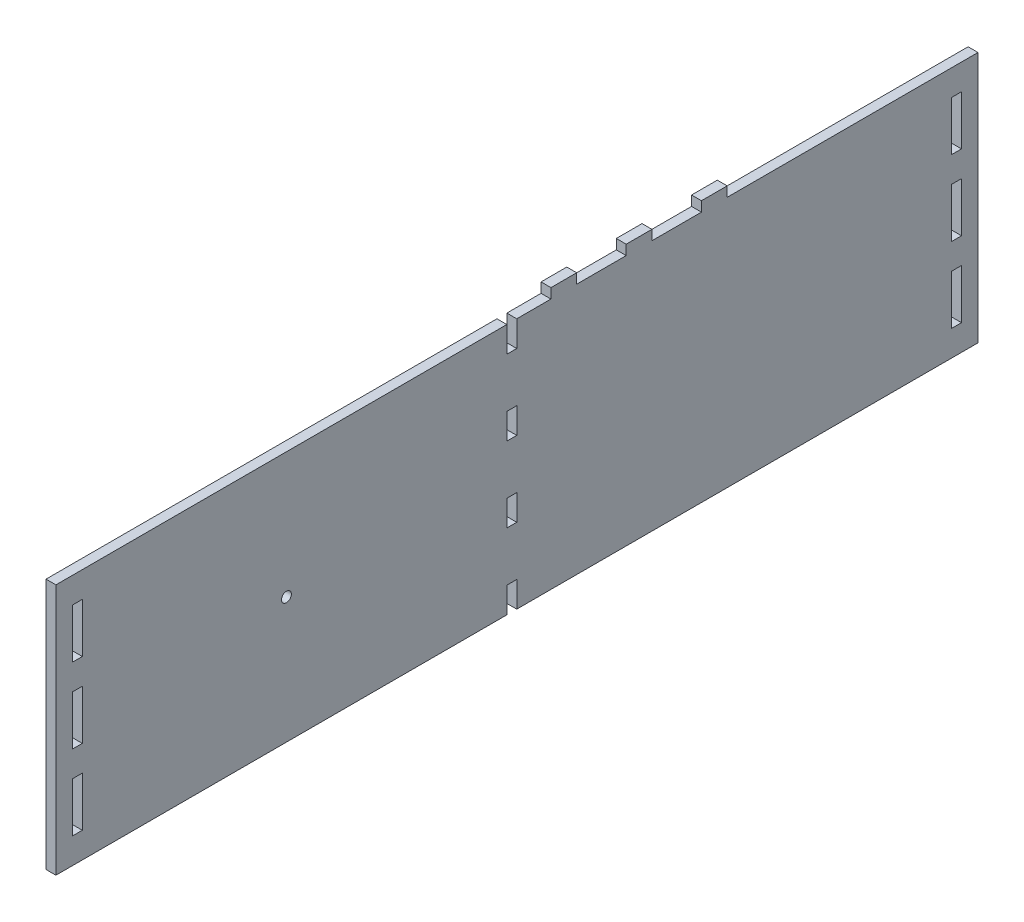
from build123d import *

# Parameters (mm, degrees)
SKETCH1_W                       = 279.4
SKETCH1_H                       = 76.2
BOSS_EXTRUDE1_DEPTH             = 3
SKETCH3_W                       = 3
SKETCH3_H                       = 15
CUT_EXTRUDE1_DEPTH              = 145.833352512
LPATTERN1_COUNT                 = 3
LPATTERN1_PITCH                 = 22.8
MIRROR1_COPY_1_SKETCH_W         = 3
MIRROR1_COPY_1_SKETCH_H         = 15
MIRROR1_COPY_1_DEPTH            = 145.833352512
MIRROR1_COPY_2_SKETCH_W         = 3
MIRROR1_COPY_2_SKETCH_H         = 15
MIRROR1_COPY_2_DEPTH            = 145.833352512
MIRROR1_COPY_3_SKETCH_W         = 3
MIRROR1_COPY_3_SKETCH_H         = 15
MIRROR1_COPY_3_DEPTH            = 145.833352512
F_3_0MM_CLEARANCE_DOWEL_HOLE1_D = 3
SKETCH6_W                       = 3
SKETCH6_H                       = 7.8
CUT_EXTRUDE2_DEPTH              = 145.833352512
LPATTERN2_COUNT                 = 4
LPATTERN2_PITCH                 = 22.8
SKETCH8_W                       = 3
SKETCH8_H                       = 7.8
BOSS_EXTRUDE2_DEPTH             = 3
LPATTERN4_COUNT                 = 3
LPATTERN4_PITCH                 = 22.8


with BuildPart() as part:
    # Sketch1 → Boss-Extrude1 (new body)
    with BuildSketch(Plane(origin=(0, 0, 0), x_dir=(0, 0, -1), z_dir=(1, 0, 0))):
        Rectangle(SKETCH1_W, SKETCH1_H)
    extrude(amount=-BOSS_EXTRUDE1_DEPTH)

    # Sketch3 → Cut-Extrude1 (cut, through all)
    with BuildSketch(Plane.ZY.offset(3)):
        with Locations((133.2, 22.8)):
            Rectangle(SKETCH3_W, SKETCH3_H)
    cut_extrude1 = extrude(amount=-CUT_EXTRUDE1_DEPTH, mode=Mode.SUBTRACT)

    # LPattern1: Cut-Extrude1 ×3
    with Locations(*[(0, -i * LPATTERN1_PITCH, 0) for i in range(1, LPATTERN1_COUNT)]):
        add(cut_extrude1, mode=Mode.SUBTRACT)

    # Mirror1 copy 1 sketch → Mirror1 copy 1 (cut, through all)
    with BuildSketch(Plane(origin=(-3, -22.8, 0), x_dir=(0, 0, -1), z_dir=(-1, 0, 0))):
        with Locations((133.2, -22.8)):
            Rectangle(MIRROR1_COPY_1_SKETCH_W, MIRROR1_COPY_1_SKETCH_H)
    extrude(amount=-MIRROR1_COPY_1_DEPTH, mode=Mode.SUBTRACT)

    # Mirror1 copy 2 sketch → Mirror1 copy 2 (cut, through all)
    with BuildSketch(Plane(origin=(-3, -45.6, 0), x_dir=(0, 0, -1), z_dir=(-1, 0, 0))):
        with Locations((133.2, -22.8)):
            Rectangle(MIRROR1_COPY_2_SKETCH_W, MIRROR1_COPY_2_SKETCH_H)
    extrude(amount=-MIRROR1_COPY_2_DEPTH, mode=Mode.SUBTRACT)

    # Mirror1 copy 3 sketch → Mirror1 copy 3 (cut, through all)
    with BuildSketch(Plane(origin=(-3, 0, 0), x_dir=(0, 0, -1), z_dir=(-1, 0, 0))):
        with Locations((133.2, -22.8)):
            Rectangle(MIRROR1_COPY_3_SKETCH_W, MIRROR1_COPY_3_SKETCH_H)
    extrude(amount=-MIRROR1_COPY_3_DEPTH, mode=Mode.SUBTRACT)

    # Ø3.0mm Clearance Dowel Hole1 (through all)
    with Locations(Plane.ZY.offset(3)):
        with Locations((69.85, 0)):
            Hole(F_3_0MM_CLEARANCE_DOWEL_HOLE1_D / 2)

    # Sketch6 → Cut-Extrude2 (cut, through all)
    with BuildSketch(Plane.ZY.offset(3)):
        with Locations((1.56, 34.2)):
            Rectangle(SKETCH6_W, SKETCH6_H)
    cut_extrude2 = extrude(amount=-CUT_EXTRUDE2_DEPTH, mode=Mode.SUBTRACT)

    # LPattern2: Cut-Extrude2 ×4
    with Locations(*[(0, -i * LPATTERN2_PITCH, 0) for i in range(1, LPATTERN2_COUNT)]):
        add(cut_extrude2, mode=Mode.SUBTRACT)

    # Sketch8 → Boss-Extrude2 (add)
    with BuildSketch(Plane(origin=(0, 38.1, 0), x_dir=(1, 0, 0), z_dir=(0, 1, 0))):
        with Locations((-1.5, 14.2)):
            Rectangle(SKETCH8_W, SKETCH8_H)
    boss_extrude2 = extrude(amount=BOSS_EXTRUDE2_DEPTH)

    # LPattern4: Boss-Extrude2 ×3
    with Locations(*[(0, 0, -i * LPATTERN4_PITCH) for i in range(1, LPATTERN4_COUNT)]):
        add(boss_extrude2)


solid = part.part
